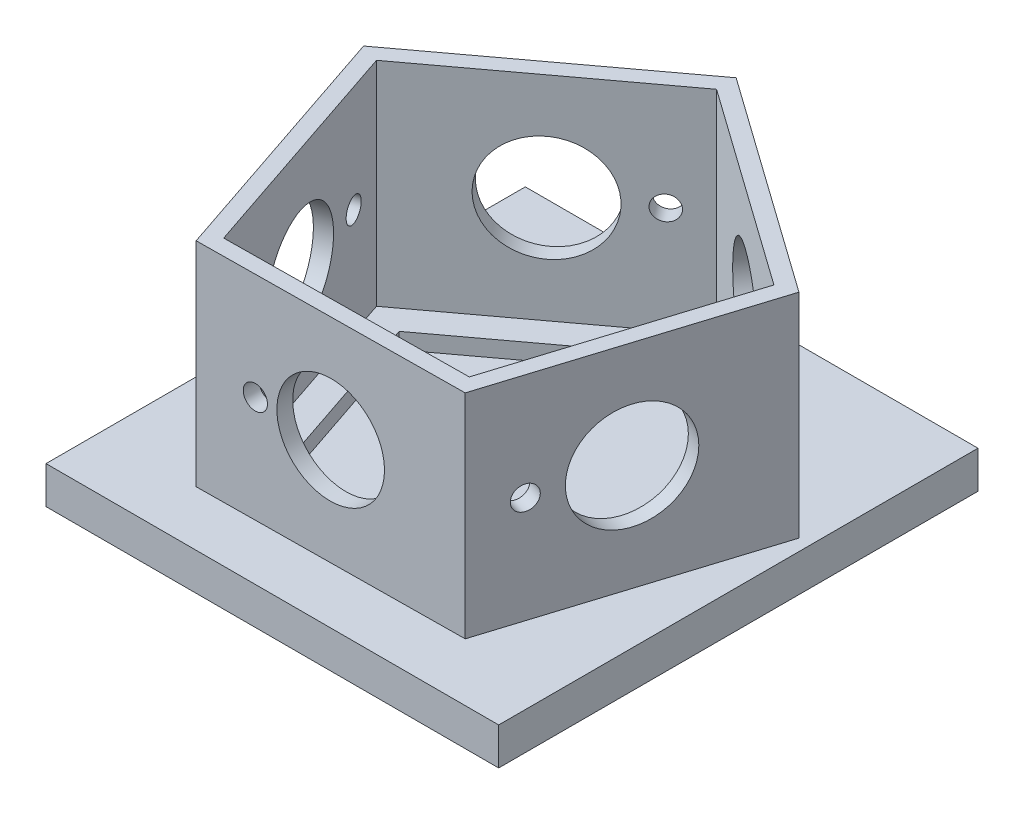
from build123d import *

# Parameters (mm, degrees)
BOSS_EXTRUDE1_DEPTH = 40
CUT_EXTRUDE1_DEPTH  = 40
SKETCH4_R           = 10
SKETCH4_R_2         = 2.25
CUT_EXTRUDE2_DEPTH  = 20
SKETCH11_R          = 10
SKETCH11_R_2        = 2.25
CUT_EXTRUDE7_DEPTH  = 8
SKETCH12_R          = 10
SKETCH12_R_2        = 2.25
CUT_EXTRUDE8_DEPTH  = 8
SKETCH13_R          = 10
SKETCH13_R_2        = 2.25
CUT_EXTRUDE9_DEPTH  = 8
SKETCH14_R          = 10
SKETCH14_R_2        = 2.25
CUT_EXTRUDE10_DEPTH = 8
SKETCH15_W          = 85
SKETCH15_H          = 90
BOSS_EXTRUDE3_DEPTH = 7
CUT_EXTRUDE11_DEPTH = 3


with BuildPart() as part:
    # Sketch2 → Boss-Extrude1 (new body)
    with BuildSketch(Plane(origin=(0, 0, 0), x_dir=(1, 0, 0), z_dir=(0, 1, 0))):
        Polygon((25.361153288, -34.144236677), (40.310126149, 13.568740702), (-0.448125237, 42.530179616), (-40.587082777, 12.716355848), (-24.636071423, -34.671039488), align=None)
    extrude(amount=BOSS_EXTRUDE1_DEPTH)

    # Sketch3 → Cut-Extrude1 (cut)
    with BuildSketch(Plane(origin=(0, 40, 0), x_dir=(1, 0, 0), z_dir=(0, 1, 0))):
        Polygon((36.795683634, 12.385748641), (-0.409055392, 38.82218151), (-37.04849377, 11.607679049), (-22.48817299, -31.648241327), (23.150038517, -31.167367874), align=None)
    extrude(amount=-CUT_EXTRUDE1_DEPTH, mode=Mode.SUBTRACT)

    # Sketch4 → Cut-Extrude2 (cut)
    with BuildSketch(Plane(origin=(0.362540932, 0, 34.407638083), x_dir=(0.9999444942192355, 0, -0.010536056218412446), z_dir=(0.010536056218412445, 0, 0.9999444942192354))):
        with Locations((0, 20)):
            Circle(SKETCH4_R)
        with Locations((-14, 20)):
            Circle(SKETCH4_R_2)
    extrude(amount=-CUT_EXTRUDE2_DEPTH, mode=Mode.SUBTRACT)

    # Sketch11 → Cut-Extrude7 (cut)
    with BuildSketch(Plane(origin=(32.835639718, 0, 10.287747988), x_dir=(0.2989794572228314, 0, -0.9542595475858449), z_dir=(0.9542595475858447, 0, 0.29897945722283137))):
        with Locations((0, 20)):
            Circle(SKETCH11_R)
        with Locations((-16, 20)):
            Circle(SKETCH11_R_2)
    extrude(amount=-CUT_EXTRUDE7_DEPTH, mode=Mode.SUBTRACT)

    # Sketch12 → Cut-Extrude8 (cut)
    with BuildSketch(Plane(origin=(19.931000456, 0, -28.049460159), x_dir=(-0.8151650277175302, 0, -0.579228778278737), z_dir=(0.579228778278737, 0, -0.8151650277175302))):
        with Locations((0, 20)):
            Circle(SKETCH12_R)
        with Locations((-16, 20)):
            Circle(SKETCH12_R_2)
    extrude(amount=-CUT_EXTRUDE8_DEPTH, mode=Mode.SUBTRACT)

    # Sketch13 → Cut-Extrude9 (cut)
    with BuildSketch(Plane(origin=(-20.517604007, 0, -27.623267732), x_dir=(-0.8027791507925155, 0, 0.5962764753475085), z_dir=(-0.5962764753475084, 0, -0.8027791507925154))):
        with Locations((0, 20)):
            Circle(SKETCH13_R)
        with Locations((-16, 20)):
            Circle(SKETCH13_R_2)
    extrude(amount=-CUT_EXTRUDE9_DEPTH, mode=Mode.SUBTRACT)

    # Sketch14 → Cut-Extrude10 (cut)
    with BuildSketch(Plane(origin=(-32.6115771, 0, 10.97734182), x_dir=(0.3190202270679786, 0, 0.947747906735486), z_dir=(-0.947747906735486, 0, 0.3190202270679786))):
        with Locations((0, 20)):
            Circle(SKETCH14_R)
        with Locations((-16, 20)):
            Circle(SKETCH14_R_2)
    extrude(amount=-CUT_EXTRUDE10_DEPTH, mode=Mode.SUBTRACT)

    # Sketch15 → Boss-Extrude3 (add)
    with BuildSketch(Plane.XZ):
        Rectangle(SKETCH15_W, SKETCH15_H)
    extrude(amount=BOSS_EXTRUDE3_DEPTH)

    # Sketch16 → Cut-Extrude11 (cut)
    with BuildSketch(Plane(origin=(0, 0, 0), x_dir=(1, 0, 0), z_dir=(0, 1, 0))):
        Polygon((19.274476499, -25.949619875), (30.635695873, 10.312242933), (-0.34057518, 32.322936508), (-30.84618291, 9.664430445), (-18.723414282, -26.349990011), align=None)
    extrude(amount=-CUT_EXTRUDE11_DEPTH, mode=Mode.SUBTRACT)


solid = part.part
